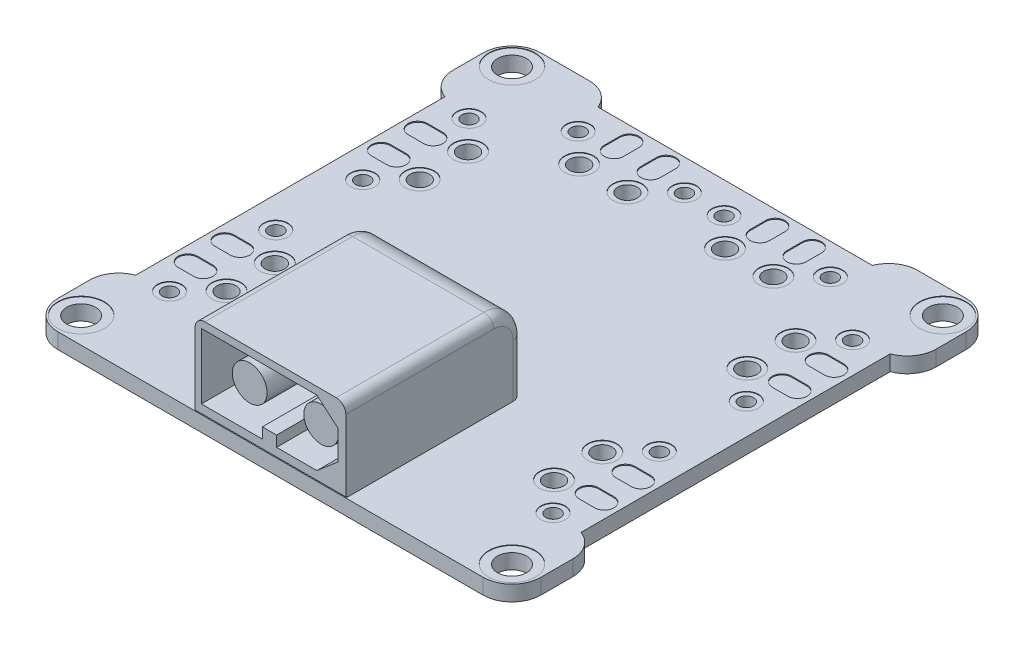
from build123d import *

# Parameters (mm, degrees)
BOSS_EXTRUDE1_DEPTH = 1.6
SKETCH3_R           = 0.75
SKETCH3_R_2         = 1
SKETCH3_R_3         = 1.5
CUT_EXTRUDE2_DEPTH  = 36.462233432
SKETCH4_R           = 0.75
SKETCH4_R_2         = 1
SKETCH4_R_3         = 1.5
CUT_EXTRUDE3_DEPTH  = 0.1
FILLET1_R           = 3
SKETCH5_W           = 15.6
SKETCH5_H           = 18.3
BOSS_EXTRUDE2_DEPTH = 8.5
CUT_EXTRUDE4_DEPTH  = 8.7
SKETCH7_R           = 1.8
BOSS_EXTRUDE3_DEPTH = 7.7
FILLET2_R           = 3
FILLET3_R           = 1
SKETCH8_W           = 15.6
SKETCH8_H           = 0.1
CUT_EXTRUDE5_DEPTH  = 0.1
SKETCH9_W           = 1.47
SKETCH9_H           = 8.7
BOSS_EXTRUDE4_DEPTH = 1.1
SKETCH10_R          = 2.4
SKETCH10_R_2        = 1.25
SKETCH10_R_3        = 1.5
CUT_EXTRUDE6_DEPTH  = 0.05


with BuildPart() as part:
    # Sketch1 → Boss-Extrude1 (new body)
    with BuildSketch(Plane(origin=(0, 0, 0), x_dir=(1, 0, 0), z_dir=(0, 1, 0))):
        Polygon((-25, -25.1), (25, -25.1), (25, -16), (23.05, -16), (23.05, 16), (25, 16), (25, 24.9), (14.2, 24.9), (14.2, 23), (-14.2, 23), (-14.2, 24.9), (-25, 24.9), (-25, 16), (-23.05, 16), (-23.05, -16), (-25, -16), align=None)
    extrude(amount=BOSS_EXTRUDE1_DEPTH)

    # Sketch3 → Cut-Extrude2 (cut, through all)
    with BuildSketch(Plane(origin=(0, 1.6, 0), x_dir=(1, 0, 0), z_dir=(0, 1, 0))):
        with Locations(Location((-2.05, 19.8, 0), (0, 0, 270))):
            Circle(SKETCH3_R)
        with Locations(Location((-13.05, 19.8, 0), (0, 0, 270))):
            Circle(SKETCH3_R)
        with Locations(Location((-5.05, 16.9, 0), (0, 0, 270))):
            Circle(SKETCH3_R_2)
        with Locations(Location((-10.05, 16.9, 0), (0, 0, 270))):
            Circle(SKETCH3_R_2)
        with Locations(Location((-22.3, -22.4, 0), (0, 0, 270))):
            Circle(SKETCH3_R_3)
        with Locations(Location((-22.3, 22.2, 0), (0, 0, 270))):
            Circle(SKETCH3_R_3)
        with Locations(Location((-19.85, -4.7, 0), (0, 0, 270))):
            Circle(SKETCH3_R)
        with Locations(Location((-19.85, 4.3, 0), (0, 0, 270))):
            Circle(SKETCH3_R)
        with Locations(Location((-19.85, 15.3, 0), (0, 0, 270))):
            Circle(SKETCH3_R)
        with Locations(Location((-16.95, 7.3, 0), (0, 0, 270))):
            Circle(SKETCH3_R_2)
        with Locations(Location((-16.95, 12.3, 0), (0, 0, 270))):
            Circle(SKETCH3_R_2)
        with Locations(Location((-16.95, -12.7, 0), (0, 0, 270))):
            Circle(SKETCH3_R_2)
        with Locations(Location((-16.95, -7.7, 0), (0, 0, 270))):
            Circle(SKETCH3_R_2)
        with Locations(Location((-19.85, -15.7, 0), (0, 0, 270))):
            Circle(SKETCH3_R)
        with Locations(Location((16.95, 7.3, 0), (0, 0, 270))):
            Circle(SKETCH3_R_2)
        with Locations(Location((19.85, 15.3, 0), (0, 0, 270))):
            Circle(SKETCH3_R)
        with Locations(Location((19.85, 4.3, 0), (0, 0, 270))):
            Circle(SKETCH3_R)
        with Locations(Location((19.85, -4.7, 0), (0, 0, 270))):
            Circle(SKETCH3_R)
        with Locations(Location((19.85, -15.7, 0), (0, 0, 270))):
            Circle(SKETCH3_R)
        with Locations(Location((16.95, -7.7, 0), (0, 0, 270))):
            Circle(SKETCH3_R_2)
        with Locations(Location((16.95, -12.7, 0), (0, 0, 270))):
            Circle(SKETCH3_R_2)
        with Locations(Location((22.3, 22.2, 0), (0, 0, 270))):
            Circle(SKETCH3_R_3)
        with Locations(Location((22.3, -22.4, 0), (0, 0, 270))):
            Circle(SKETCH3_R_3)
        with Locations(Location((10.05, 16.9, 0), (0, 0, 270))):
            Circle(SKETCH3_R_2)
        with Locations(Location((5.05, 16.9, 0), (0, 0, 270))):
            Circle(SKETCH3_R_2)
        with Locations(Location((13.05, 19.8, 0), (0, 0, 270))):
            Circle(SKETCH3_R)
        with Locations(Location((2.05, 19.8, 0), (0, 0, 270))):
            Circle(SKETCH3_R)
        with Locations(Location((16.95, 12.3, 0), (0, 0, 270))):
            Circle(SKETCH3_R_2)
    extrude(amount=-CUT_EXTRUDE2_DEPTH, mode=Mode.SUBTRACT)

    # Sketch4 → Cut-Extrude3 (cut)
    with BuildSketch(Plane(origin=(0, 1.6, 0), x_dir=(1, 0, 0), z_dir=(0, 1, 0))):
        with Locations(Location((-2.05, 19.8, 0), (0, 0, 270))):
            Circle(SKETCH4_R)
        with Locations(Location((-13.05, 19.8, 0), (0, 0, 270))):
            Circle(SKETCH4_R)
        with Locations(Location((-5.05, 16.9, 0), (0, 0, 270))):
            Circle(SKETCH4_R_2)
        with Locations(Location((-10.05, 16.9, 0), (0, 0, 270))):
            Circle(SKETCH4_R_2)
        with Locations(Location((-22.3, -22.4, 0), (0, 0, 270))):
            Circle(SKETCH4_R_3)
        with Locations(Location((-22.3, 22.2, 0), (0, 0, 270))):
            Circle(SKETCH4_R_3)
        with Locations(Location((-19.85, -4.7, 0), (0, 0, 270))):
            Circle(SKETCH4_R)
        with Locations(Location((-19.85, 4.3, 0), (0, 0, 270))):
            Circle(SKETCH4_R)
        with Locations(Location((-19.85, 15.3, 0), (0, 0, 270))):
            Circle(SKETCH4_R)
        with Locations(Location((-16.95, 7.3, 0), (0, 0, 270))):
            Circle(SKETCH4_R_2)
        with Locations(Location((-16.95, 12.3, 0), (0, 0, 270))):
            Circle(SKETCH4_R_2)
        with Locations(Location((-16.95, -12.7, 0), (0, 0, 270))):
            Circle(SKETCH4_R_2)
        with Locations(Location((-16.95, -7.7, 0), (0, 0, 270))):
            Circle(SKETCH4_R_2)
        with Locations(Location((-19.85, -15.7, 0), (0, 0, 270))):
            Circle(SKETCH4_R)
        with Locations(Location((16.95, 7.3, 0), (0, 0, 270))):
            Circle(SKETCH4_R_2)
        with Locations(Location((19.85, 15.3, 0), (0, 0, 270))):
            Circle(SKETCH4_R)
        with Locations(Location((19.85, 4.3, 0), (0, 0, 270))):
            Circle(SKETCH4_R)
        with Locations(Location((19.85, -4.7, 0), (0, 0, 270))):
            Circle(SKETCH4_R)
        with Locations(Location((19.85, -15.7, 0), (0, 0, 270))):
            Circle(SKETCH4_R)
        with Locations(Location((16.95, -7.7, 0), (0, 0, 270))):
            Circle(SKETCH4_R_2)
        with Locations(Location((16.95, -12.7, 0), (0, 0, 270))):
            Circle(SKETCH4_R_2)
        with Locations(Location((22.3, 22.2, 0), (0, 0, 270))):
            Circle(SKETCH4_R_3)
        with Locations(Location((22.3, -22.4, 0), (0, 0, 270))):
            Circle(SKETCH4_R_3)
        with Locations(Location((10.05, 16.9, 0), (0, 0, 270))):
            Circle(SKETCH4_R_2)
        with Locations(Location((5.05, 16.9, 0), (0, 0, 270))):
            Circle(SKETCH4_R_2)
        with Locations(Location((13.05, 19.8, 0), (0, 0, 270))):
            Circle(SKETCH4_R)
        with Locations(Location((2.05, 19.8, 0), (0, 0, 270))):
            Circle(SKETCH4_R)
        with Locations(Location((16.95, 12.3, 0), (0, 0, 270))):
            Circle(SKETCH4_R_2)
        with BuildLine():
            Line((-4.65, 19.9), (-4.65, 21.5))
            ThreePointArc((-4.65, 21.5), (-5.65, 22.5), (-6.65, 21.5))
            Line((-6.65, 21.5), (-6.65, 19.9))
            ThreePointArc((-6.65, 19.9), (-5.65, 18.9), (-4.65, 19.9))
        make_face()
        with BuildLine():
            Line((-10.45, 21.5), (-10.45, 19.9))
            ThreePointArc((-10.45, 19.9), (-9.45, 18.9), (-8.45, 19.9))
            Line((-8.45, 19.9), (-8.45, 21.5))
            ThreePointArc((-8.45, 21.5), (-9.45, 22.5), (-10.45, 21.5))
        make_face()
        with BuildLine():
            Line((-19.95, -7.3), (-21.55, -7.3))
            ThreePointArc((-21.55, -7.3), (-22.55, -8.3), (-21.55, -9.3))
            Line((-21.55, -9.3), (-19.95, -9.3))
            ThreePointArc((-19.95, -9.3), (-18.95, -8.3), (-19.95, -7.3))
        make_face()
        with BuildLine():
            Line((-19.95, 8.9), (-21.55, 8.9))
            ThreePointArc((-21.55, 8.9), (-22.55, 7.9), (-21.55, 6.9))
            Line((-21.55, 6.9), (-19.95, 6.9))
            ThreePointArc((-19.95, 6.9), (-18.95, 7.9), (-19.95, 8.9))
        make_face()
        with BuildLine():
            Line((-19.95, 12.7), (-21.55, 12.7))
            ThreePointArc((-21.55, 12.7), (-22.55, 11.7), (-21.55, 10.7))
            Line((-21.55, 10.7), (-19.95, 10.7))
            ThreePointArc((-19.95, 10.7), (-18.95, 11.7), (-19.95, 12.7))
        make_face()
        with BuildLine():
            Line((-19.95, -11.1), (-21.55, -11.1))
            ThreePointArc((-21.55, -11.1), (-22.55, -12.1), (-21.55, -13.1))
            Line((-21.55, -13.1), (-19.95, -13.1))
            ThreePointArc((-19.95, -13.1), (-18.95, -12.1), (-19.95, -11.1))
        make_face()
        with BuildLine():
            Line((21.55, -7.3), (19.95, -7.3))
            ThreePointArc((19.95, -7.3), (18.95, -8.3), (19.95, -9.3))
            Line((19.95, -9.3), (21.55, -9.3))
            ThreePointArc((21.55, -9.3), (22.55, -8.3), (21.55, -7.3))
        make_face()
        with BuildLine():
            Line((21.55, -11.1), (19.95, -11.1))
            ThreePointArc((19.95, -11.1), (18.95, -12.1), (19.95, -13.1))
            Line((19.95, -13.1), (21.55, -13.1))
            ThreePointArc((21.55, -13.1), (22.55, -12.1), (21.55, -11.1))
        make_face()
        with BuildLine():
            Line((21.55, 12.7), (19.95, 12.7))
            ThreePointArc((19.95, 12.7), (18.95, 11.7), (19.95, 10.7))
            Line((19.95, 10.7), (21.55, 10.7))
            ThreePointArc((21.55, 10.7), (22.55, 11.7), (21.55, 12.7))
        make_face()
        with BuildLine():
            Line((19.95, 6.9), (21.55, 6.9))
            ThreePointArc((21.55, 6.9), (22.55, 7.9), (21.55, 8.9))
            Line((21.55, 8.9), (19.95, 8.9))
            ThreePointArc((19.95, 8.9), (18.95, 7.9), (19.95, 6.9))
        make_face()
        with BuildLine():
            Line((8.45, 21.5), (8.45, 19.9))
            ThreePointArc((8.45, 19.9), (9.45, 18.9), (10.45, 19.9))
            Line((10.45, 19.9), (10.45, 21.5))
            ThreePointArc((10.45, 21.5), (9.45, 22.5), (8.45, 21.5))
        make_face()
        with BuildLine():
            Line((4.65, 21.5), (4.65, 19.9))
            ThreePointArc((4.65, 19.9), (5.65, 18.9), (6.65, 19.9))
            Line((6.65, 19.9), (6.65, 21.5))
            ThreePointArc((6.65, 21.5), (5.65, 22.5), (4.65, 21.5))
        make_face()
    extrude(amount=-CUT_EXTRUDE3_DEPTH, mode=Mode.SUBTRACT)

    # Fillet1
    # the kernel refuses this fillet: 3 mm, written as the material it takes off along each edge
    with BuildSketch(Plane(origin=(-25, -7.025622748, 16), x_dir=(1, 0, 0), z_dir=(0, 1, 0))) as fillet1_piece_1:
        with BuildLine():
            CenterArc((3, -2.810249099), FILLET1_R, 110.487315115, 69.512684885)
            Line((0, -2.810249099), (-0.06, -2.810249099))
            Line((-0.06, -2.810249099), (-0.06, 0))
            Line((-0.06, 0), (0, 0.06))
            ThreePointArc((0, 0.06), (0.975, 0.06), (1.929, 0.056204982))
            Line((1.929, 0.056204982), (1.95, 0))
        make_face()
    extrude(amount=15.651245496, mode=Mode.SUBTRACT)
    with BuildSketch(Plane(origin=(-25, -7.025622748, -16), x_dir=(0, 0, -1), z_dir=(0, 1, 0))) as fillet1_piece_2:
        with BuildLine():
            CenterArc((2.810249099, -3), FILLET1_R, 90, 69.512684885)
            Line((0, -1.95), (-0.056204982, -1.929))
            ThreePointArc((-0.056204982, -1.929), (-0.06, -0.975), (-0.06, 0))
            Line((-0.06, 0), (0, 0.06))
            Line((0, 0.06), (2.810249099, 0.06))
            Line((2.810249099, 0.06), (2.810249099, 0))
        make_face()
    extrude(amount=15.651245496, mode=Mode.SUBTRACT)
    with BuildSketch(Plane(origin=(-14.2, -6.977642868, -24.9), x_dir=(0, 0, 1), z_dir=(0, 1, 0))) as fillet1_piece_3:
        with BuildLine():
            CenterArc((3, -2.791057147), FILLET1_R, 111.510188267, 68.489811733)
            Line((0, -2.791057147), (-0.06, -2.791057147))
            Line((-0.06, -2.791057147), (-0.06, 0))
            Line((-0.06, 0), (0, 0.06))
            ThreePointArc((0, 0.06), (0.95, 0.06), (1.878, 0.055821143))
            Line((1.878, 0.055821143), (1.9, 0))
        make_face()
    extrude(amount=15.555285737, mode=Mode.SUBTRACT)
    with BuildSketch(Plane(origin=(25, -7.025622748, 16), x_dir=(-1, 0, 0), z_dir=(0, 1, 0))) as fillet1_piece_4:
        with BuildLine():
            CenterArc((3, 2.810249099), FILLET1_R, 180, 69.512684885)
            Line((0, 2.810249099), (-0.06, 2.810249099))
            Line((-0.06, 2.810249099), (-0.06, 0))
            Line((-0.06, 0), (0, -0.06))
            ThreePointArc((0, -0.06), (0.975, -0.06), (1.929, -0.056204982))
            Line((1.929, -0.056204982), (1.95, 0))
        make_face()
    extrude(amount=15.651245496, mode=Mode.SUBTRACT)
    with BuildSketch(Plane(origin=(25, -7.025622748, -16), x_dir=(0, 0, -1), z_dir=(0, 1, 0))) as fillet1_piece_5:
        with BuildLine():
            CenterArc((2.810249099, 3), FILLET1_R, 200.487315115, 69.512684885)
            Line((0, 1.95), (-0.056204982, 1.929))
            ThreePointArc((-0.056204982, 1.929), (-0.06, 0.975), (-0.06, 0))
            Line((-0.06, 0), (0, -0.06))
            Line((0, -0.06), (2.810249099, -0.06))
            Line((2.810249099, -0.06), (2.810249099, 0))
        make_face()
    extrude(amount=15.651245496, mode=Mode.SUBTRACT)
    with BuildSketch(Plane(origin=(25, -7.5, -24.9), x_dir=(-1, 0, 0), z_dir=(0, 1, 0)), Plane(origin=(-25, -7.5, 25.1), x_dir=(1, 0, 0), z_dir=(0, 1, 0))) as fillet1_piece_6:
        with BuildLine():
            CenterArc((FILLET1_R, FILLET1_R), FILLET1_R, 180, 90)
            Line((0, FILLET1_R), (-FILLET1_R * 0.02, FILLET1_R))
            Line((-FILLET1_R * 0.02, FILLET1_R), (-FILLET1_R * 0.02, -FILLET1_R * 0.02))
            Line((-FILLET1_R * 0.02, -FILLET1_R * 0.02), (FILLET1_R, -FILLET1_R * 0.02))
            Line((FILLET1_R, -FILLET1_R * 0.02), (FILLET1_R, 0))
        make_face()
    extrude(amount=16.6, mode=Mode.SUBTRACT)
    with BuildSketch(Plane(origin=(25, -7.5, 25.1), x_dir=(-1, 0, 0), z_dir=(0, 1, 0)), Plane(origin=(-25, -7.5, -24.9), x_dir=(1, 0, 0), z_dir=(0, 1, 0))) as fillet1_piece_7:
        with BuildLine():
            CenterArc((FILLET1_R, -FILLET1_R), FILLET1_R, 90, 90)
            Line((0, -FILLET1_R), (-FILLET1_R * 0.02, -FILLET1_R))
            Line((-FILLET1_R * 0.02, -FILLET1_R), (-FILLET1_R * 0.02, FILLET1_R * 0.02))
            Line((-FILLET1_R * 0.02, FILLET1_R * 0.02), (FILLET1_R, FILLET1_R * 0.02))
            Line((FILLET1_R, FILLET1_R * 0.02), (FILLET1_R, 0))
        make_face()
    extrude(amount=16.6, mode=Mode.SUBTRACT)
    with BuildSketch(Plane(origin=(14.2, -6.977642868, -24.9), x_dir=(0, 0, 1), z_dir=(0, 1, 0))) as fillet1_piece_8:
        with BuildLine():
            CenterArc((3, 2.791057147), FILLET1_R, 180, 68.489811733)
            Line((0, 2.791057147), (-0.06, 2.791057147))
            Line((-0.06, 2.791057147), (-0.06, 0))
            Line((-0.06, 0), (0, -0.06))
            ThreePointArc((0, -0.06), (0.95, -0.06), (1.878, -0.055821143))
            Line((1.878, -0.055821143), (1.9, 0))
        make_face()
    extrude(amount=15.555285737, mode=Mode.SUBTRACT)

    # Sketch5 → Boss-Extrude2 (add)
    with BuildSketch(Plane(origin=(0, 1.6, 0), x_dir=(1, 0, 0), z_dir=(0, 1, 0))):
        with Locations((0, -15.95)):
            Rectangle(SKETCH5_W, SKETCH5_H)
    extrude(amount=BOSS_EXTRUDE2_DEPTH)

    # Sketch6 → Cut-Extrude4 (cut)
    with BuildSketch(Plane.XY.offset(25.1)):
        Polygon((-7.15, 9.33), (-7.15, 2.56), (4.8, 2.56), (7, 4.445), (7, 7.445), (4.8, 9.33), align=None)
    extrude(amount=-CUT_EXTRUDE4_DEPTH, mode=Mode.SUBTRACT)

    # Sketch7 → Boss-Extrude3 (add)
    with BuildSketch(Plane.XY.offset(16.4)):
        with Locations(Location((-3.15, 5.945, 0), (0, 0, 180))):
            Circle(SKETCH7_R)
        with Locations(Location((4.25, 5.945, 0), (0, 0, 180))):
            Circle(SKETCH7_R)
    extrude(amount=BOSS_EXTRUDE3_DEPTH)

    # Fillet2
    fillet2_edges = [part.edges().sort_by_distance(p)[0] for p in [
        (0, 10.1, 6.8),
    ]]
    fillet(fillet2_edges, radius=FILLET2_R)

    # Fillet3
    fillet3_edges = [part.edges().sort_by_distance(p)[0] for p in [
        (7.8, 10.1, 17.45),
        (-7.8, 10.1, 17.45),
        (-7.8, 4.35, 6.8),
        (-7.8, 9.221320344, 7.678679656),
        (7.8, 4.35, 6.8),
        (7.8, 9.221320344, 7.678679656),
    ]]
    fillet(fillet3_edges, radius=FILLET3_R)

    # Sketch8 → Cut-Extrude5 (cut)
    with BuildSketch(Plane.XY.offset(25.1)):
        with Locations((0, 1.65)):
            Rectangle(SKETCH8_W, SKETCH8_H)
    extrude(amount=-CUT_EXTRUDE5_DEPTH, mode=Mode.SUBTRACT)

    # Sketch9 → Boss-Extrude4 (add)
    with BuildSketch(Plane(origin=(0, 2.56, 0), x_dir=(1, 0, 0), z_dir=(0, 1, 0))):
        with Locations((-0.105, -20.75)):
            Rectangle(SKETCH9_W, SKETCH9_H)
    extrude(amount=BOSS_EXTRUDE4_DEPTH)

    # Sketch10 → Cut-Extrude6 (cut)
    with BuildSketch(Plane(origin=(0, 1.6, 0), x_dir=(1, 0, 0), z_dir=(0, 1, 0))):
        with Locations(Location((-22.3, 22.2, 0), (0, 0, 270))):
            Circle(SKETCH10_R)
        with Locations(Location((2.05, 19.8, 0), (0, 0, 90))):
            Circle(SKETCH10_R_2)
        with Locations(Location((-22.3, -22.4, 0), (0, 0, 270))):
            Circle(SKETCH10_R)
        with Locations(Location((13.05, 19.8, 0), (0, 0, 90))):
            Circle(SKETCH10_R_2)
        with Locations(Location((-10.05, 16.9, 0), (0, 0, 270))):
            Circle(SKETCH10_R_3)
        with Locations(Location((-16.95, 12.3, 0), (0, 0, 270))):
            Circle(SKETCH10_R_3)
        with Locations(Location((-16.95, 7.3, 0), (0, 0, 270))):
            Circle(SKETCH10_R_3)
        with Locations(Location((-19.85, 15.3, 0), (0, 0, 270))):
            Circle(SKETCH10_R_2)
        with Locations(Location((-19.85, 4.3, 0), (0, 0, 270))):
            Circle(SKETCH10_R_2)
        with Locations(Location((-16.95, -7.7, 0), (0, 0, 270))):
            Circle(SKETCH10_R_3)
        with Locations(Location((-19.85, -4.7, 0), (0, 0, 270))):
            Circle(SKETCH10_R_2)
        with Locations(Location((-16.95, -12.7, 0), (0, 0, 270))):
            Circle(SKETCH10_R_3)
        with Locations(Location((-19.85, -15.7, 0), (0, 0, 270))):
            Circle(SKETCH10_R_2)
        with Locations(Location((-5.05, 16.9, 0), (0, 0, 270))):
            Circle(SKETCH10_R_3)
        with Locations(Location((-13.05, 19.8, 0), (0, 0, 270))):
            Circle(SKETCH10_R_2)
        with Locations(Location((5.05, 16.9, 0), (0, 0, 90))):
            Circle(SKETCH10_R_3)
        with Locations(Location((-2.05, 19.8, 0), (0, 0, 270))):
            Circle(SKETCH10_R_2)
        with Locations(Location((19.85, -15.7, 0), (0, 0, 90))):
            Circle(SKETCH10_R_2)
        with Locations(Location((16.95, -12.7, 0), (0, 0, 90))):
            Circle(SKETCH10_R_3)
        with Locations(Location((19.85, -4.7, 0), (0, 0, 90))):
            Circle(SKETCH10_R_2)
        with Locations(Location((16.95, -7.7, 0), (0, 0, 90))):
            Circle(SKETCH10_R_3)
        with Locations(Location((19.85, 4.3, 0), (0, 0, 90))):
            Circle(SKETCH10_R_2)
        with Locations(Location((19.85, 15.3, 0), (0, 0, 90))):
            Circle(SKETCH10_R_2)
        with Locations(Location((16.95, 7.3, 0), (0, 0, 90))):
            Circle(SKETCH10_R_3)
        with Locations(Location((16.95, 12.3, 0), (0, 0, 90))):
            Circle(SKETCH10_R_3)
        with Locations(Location((10.05, 16.9, 0), (0, 0, 90))):
            Circle(SKETCH10_R_3)
        with Locations(Location((22.3, -22.4, 0), (0, 0, 90))):
            Circle(SKETCH10_R)
        with Locations(Location((22.3, 22.2, 0), (0, 0, 90))):
            Circle(SKETCH10_R)
    extrude(amount=-CUT_EXTRUDE6_DEPTH, mode=Mode.SUBTRACT)


solid = part.part
